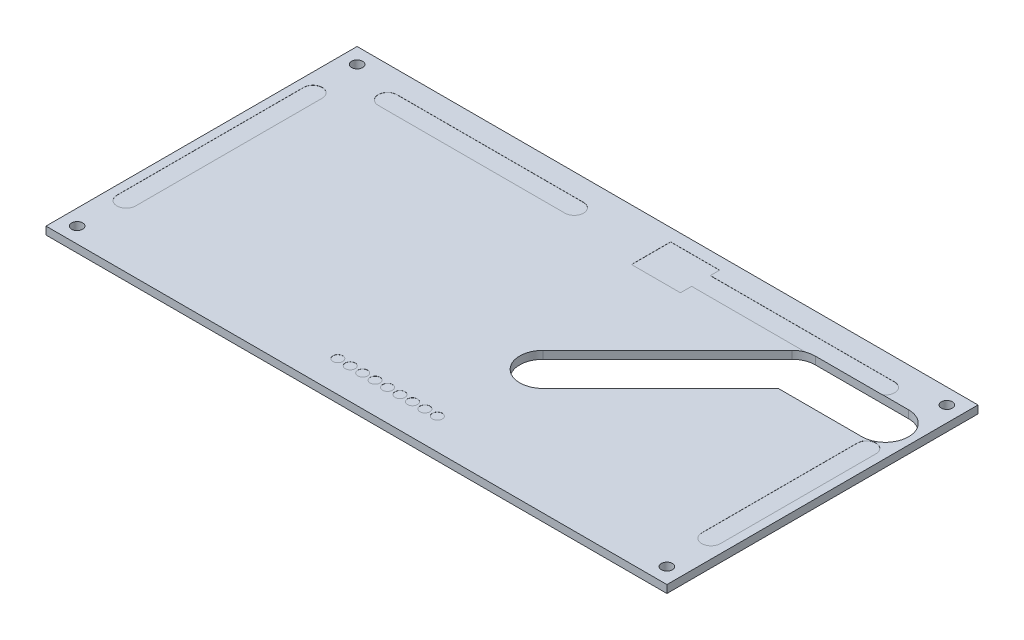
from build123d import *

# Parameters (mm, degrees)
SKETCH1_W           = 126.746
SKETCH1_H           = 63.5
BOSS_EXTRUDE1_DEPTH = 1.5875
SKETCH2_R           = 1.1303
CUT_EXTRUDE1_DEPTH  = 142.77206591
SKETCH3_R           = 1.016
CUT_EXTRUDE4_DEPTH  = 0.0254
CUT_EXTRUDE2_DEPTH  = 1.5875


with BuildPart() as part:
    # Sketch1 → Boss-Extrude1 (new body)
    with BuildSketch(Plane(origin=(0, 0, 0), x_dir=(1, 0, 0), z_dir=(0, 1, 0))):
        with Locations((63.373, 31.75)):
            Rectangle(SKETCH1_W, SKETCH1_H)
    extrude(amount=BOSS_EXTRUDE1_DEPTH)

    # Sketch2 → Cut-Extrude1 (cut, through all)
    with BuildSketch(Plane(origin=(0, 1.5875, 0), x_dir=(1, 0, 0), z_dir=(0, 1, 0))):
        with Locations((3.175, 60.325)):
            Circle(SKETCH2_R)
        with Locations((3.175, 3.175)):
            Circle(SKETCH2_R)
        with Locations((123.571, 3.175)):
            Circle(SKETCH2_R)
        with Locations((123.571, 60.325)):
            Circle(SKETCH2_R)
    extrude(amount=-CUT_EXTRUDE1_DEPTH, mode=Mode.SUBTRACT)

    # Sketch3 → Cut-Extrude4 (cut)
    with BuildSketch(Plane(origin=(0, 1.5875, 0), x_dir=(1, 0, 0), z_dir=(0, 1, 0))):
        with BuildLine():
            Line((5.588, 12.7), (5.588, 50.8))
            ThreePointArc((5.588, 50.8), (3.683, 52.705), (1.778, 50.8))
            Line((1.778, 50.8), (1.778, 12.7))
            ThreePointArc((1.778, 12.7), (3.683, 10.795), (5.588, 12.7))
        make_face()
        with BuildLine():
            Line((12.573, 55.245), (50.673, 55.245))
            ThreePointArc((50.673, 55.245), (52.578, 57.15), (50.673, 59.055))
            Line((50.673, 59.055), (12.573, 59.055))
            ThreePointArc((12.573, 59.055), (10.668, 57.15), (12.573, 55.245))
        make_face()
        with BuildLine():
            Line((76.548, 59.055), (76.548, 60.96))
            Line((76.548, 60.96), (66.548, 60.96))
            Line((66.548, 60.96), (66.548, 52.96))
            Line((66.548, 52.96), (76.548, 52.96))
            Line((76.548, 52.96), (76.548, 55.245))
            Line((76.548, 55.245), (114.173, 55.245))
            ThreePointArc((114.173, 55.245), (116.078, 57.15), (114.173, 59.055))
            Line((114.173, 59.055), (76.548, 59.055))
        make_face()
        with BuildLine():
            Line((124.968, 12.7), (124.968, 44.45))
            ThreePointArc((124.968, 44.45), (123.063, 46.355), (121.158, 44.45))
            Line((121.158, 44.45), (121.158, 12.7))
            ThreePointArc((121.158, 12.7), (123.063, 10.795), (124.968, 12.7))
        make_face()
        with Locations((63.373, 6.35)):
            Circle(SKETCH3_R)
        with Locations((65.913, 6.35)):
            Circle(SKETCH3_R)
        with Locations((68.453, 6.35)):
            Circle(SKETCH3_R)
        with Locations((70.993, 6.35)):
            Circle(SKETCH3_R)
        with Locations((73.533, 6.35)):
            Circle(SKETCH3_R)
        with Locations((60.833, 6.35)):
            Circle(SKETCH3_R)
        with Locations((58.293, 6.35)):
            Circle(SKETCH3_R)
        with Locations((55.753, 6.35)):
            Circle(SKETCH3_R)
        with Locations((53.213, 6.35)):
            Circle(SKETCH3_R)
    extrude(amount=-CUT_EXTRUDE4_DEPTH, mode=Mode.SUBTRACT)

    # Sketch4 → Cut-Extrude2 (cut)
    with BuildSketch(Plane(origin=(0, 1.5875, 0), x_dir=(1, 0, 0), z_dir=(0, 1, 0))):
        with BuildLine():
            Line((98.105403955, 54.167596045), (72.705403955, 28.767596045))
            ThreePointArc((72.705403955, 28.767596045), (72.705403955, 22.032403955), (79.440596045, 22.032403955))
            Line((79.440596045, 22.032403955), (103.445692091, 46.0375))
            Line((103.445692091, 46.0375), (120.523, 46.0375))
            ThreePointArc((120.523, 46.0375), (125.2855, 50.8), (120.523, 55.5625))
            Line((120.523, 55.5625), (101.473, 55.5625))
            ThreePointArc((101.473, 55.5625), (99.650470153, 55.199976274), (98.105403955, 54.167596045))
        make_face()
    extrude(amount=-CUT_EXTRUDE2_DEPTH, mode=Mode.SUBTRACT)


solid = part.part
